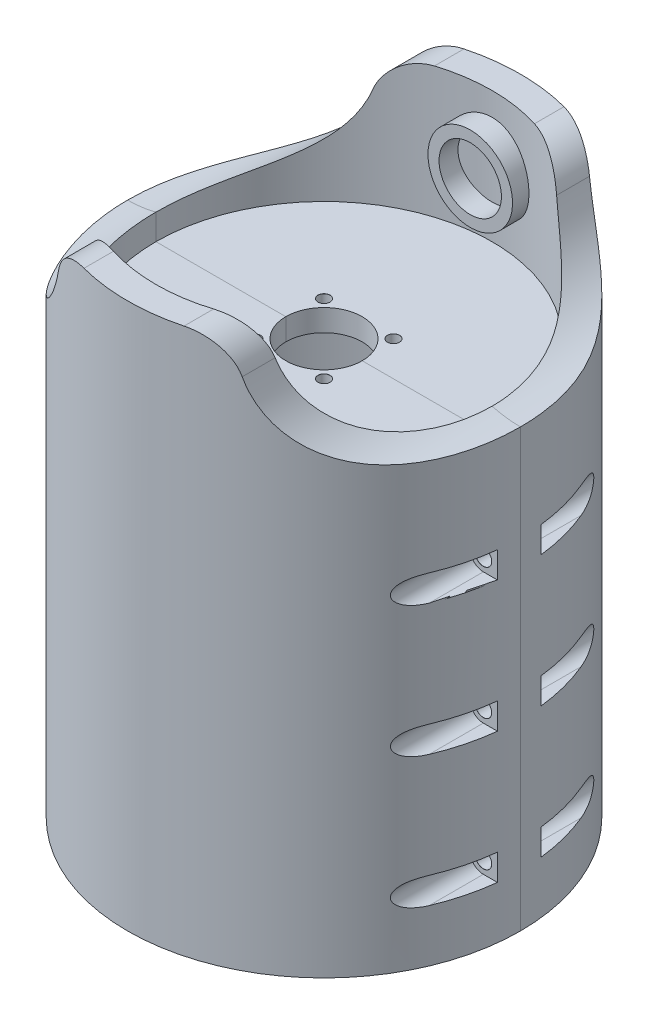
from build123d import *

# Parameters (mm, degrees)
SKETCH7_R                      = 90
BOSS_EXTRUDE3_DEPTH            = 250
SHELL3_T                       = -13
SKETCH9_R                      = 19.3675
SKETCH9_R_2                    = 14.287499999999989
BOSS_EXTRUDE4_DEPTH            = 10
CUT_EXTRUDE3_DEPTH             = 284.9013914196265
SKETCH12_R                     = 90.00000000000001
BOSS_EXTRUDE5_DEPTH            = 10
SKETCH14_R                     = 77.00000000000001
BOSS_EXTRUDE6_DEPTH            = 10
SKETCH15_R                     = 17.500000000000004
CUT_EXTRUDE4_DEPTH             = 10
CIRPATTERN1_COUNT              = 4
CUT_EXTRUDE5_DEPTH             = 281.5352029353892
CUT_EXTRUDE5_DEPTH_BACK        = 281.5352029353892
FILLET1_R                      = 20
CUT_EXTRUDE6_START             = -47.000000000000014
SKETCH19_R                     = 17.500000000000004
CUT_EXTRUDE6_DEPTH             = 47.000000000000014
M7_CLEARANCE_HOLE1_D           = 7.6
M7_CLEARANCE_HOLE1_CSINK_D     = 7.65
M7_CLEARANCE_HOLE1_CSINK_ANGLE = 90


with BuildPart() as part:
    # Sketch7 → Boss-Extrude3 (new body)
    with BuildSketch(Plane(origin=(0, 0, 0), x_dir=(1, 0, 0), z_dir=(0, 1, 0))):
        Circle(SKETCH7_R)
    extrude(amount=BOSS_EXTRUDE3_DEPTH)

    # Shell3
    shell3_openings = [part.faces().sort_by_distance(p)[0] for p in [
        (0, 250, 0),
        (0, 0, 0),
    ]]
    offset(amount=SHELL3_T, openings=shell3_openings, kind=Kind.INTERSECTION)

    # Sketch9 → Boss-Extrude4 (add)
    with BuildSketch(Plane(origin=(0, 0, 77.00000000000001), x_dir=(-1, 0, 0), z_dir=(0, 0, -1))):
        with Locations((0, 220)):
            Circle(SKETCH9_R)
        with Locations((0, 220)):
            Circle(SKETCH9_R_2, mode=Mode.SUBTRACT)
    boss_extrude4 = extrude(amount=BOSS_EXTRUDE4_DEPTH)

    # Mirror1: Boss-Extrude4 across plane
    add(boss_extrude4.mirror(Plane.XY))

    # Sketch11 → Cut-Extrude3 (cut, through all)
    with BuildSketch(Plane.XY.offset(10)):
        with BuildLine():
            Line((-82.99999999999994, 36.00000000000001), (-97.99999999999999, 36.00000000000001))
            Line((-97.99999999999999, 36.00000000000001), (-97.99999999999999, 23.999999999999993))
            Line((-97.99999999999999, 23.999999999999993), (-82.99999999999994, 23.999999999999993))
            ThreePointArc((-82.99999999999994, 23.999999999999993), (-76.99999999999994, 30), (-82.99999999999994, 36.00000000000001))
        make_face()
        with BuildLine():
            Line((-98, 95.99999999999999), (-97.99999999999999, 83.99999999999997))
            Line((-97.99999999999999, 83.99999999999997), (-82.99999999999996, 83.99999999999999))
            ThreePointArc((-82.99999999999996, 83.99999999999999), (-76.99999999999994, 90.00000000000001), (-82.99999999999997, 96))
            Line((-82.99999999999997, 96), (-98, 95.99999999999999))
        make_face()
        with BuildLine():
            Line((-98, 156), (-98, 144))
            Line((-98, 144), (-82.99999999999999, 143.99999999999997))
            ThreePointArc((-82.99999999999999, 143.99999999999997), (-76.99999999999996, 150), (-82.99999999999999, 156.00000000000003))
            Line((-82.99999999999999, 156.00000000000003), (-98, 156))
        make_face()
        with BuildLine():
            Line((-83, 216), (-98.00000000000003, 216.00000000000003))
            Line((-98.00000000000003, 216.00000000000003), (-98.00000000000003, 204))
            Line((-98.00000000000003, 204), (-83, 204))
            ThreePointArc((-83, 204), (-77, 210), (-83, 216))
        make_face()
        with BuildLine():
            Line((115.44794772964934, 96.00000000000003), (83.00000000000004, 96.00000000000003))
            ThreePointArc((83.00000000000004, 96.00000000000003), (77.00000000000004, 90.00000000000003), (83.00000000000004, 84.00000000000001))
            Line((83.00000000000004, 84.00000000000001), (115.44794772964934, 84.00000000000001))
            Line((115.44794772964934, 84.00000000000001), (115.44794772964934, 96.00000000000003))
        make_face()
        with BuildLine():
            Line((113.03560255320893, 156.00000000000003), (83.00000000000004, 156.00000000000003))
            ThreePointArc((83.00000000000004, 156.00000000000003), (77.00000000000003, 150.00000000000006), (83, 144.00000000000003))
            Line((83, 144.00000000000003), (113.03560255320893, 144.00000000000003))
            Line((113.03560255320893, 144.00000000000003), (113.03560255320893, 156.00000000000003))
        make_face()
        with BuildLine():
            Line((119.10423776125516, 216), (83.00000000000001, 216))
            ThreePointArc((83.00000000000001, 216), (77.00000000000001, 210), (83.00000000000001, 204))
            Line((83.00000000000001, 204), (119.10423776125516, 204))
            Line((119.10423776125516, 204), (119.10423776125516, 216))
        make_face()
        with BuildLine():
            Line((97.99999999999999, 23.999999999999993), (82.99999999999994, 23.999999999999993))
            ThreePointArc((82.99999999999994, 23.999999999999993), (76.99999999999994, 30), (82.99999999999994, 36.00000000000001))
            Line((82.99999999999994, 36.00000000000001), (97.99999999999999, 36.00000000000001))
            Line((97.99999999999999, 36.00000000000001), (97.99999999999999, 23.999999999999993))
        make_face()
    cut_extrude3 = extrude(amount=CUT_EXTRUDE3_DEPTH, mode=Mode.SUBTRACT)

    # Mirror2: Cut-Extrude3 across plane
    add(cut_extrude3.mirror(Plane.XY), mode=Mode.SUBTRACT)

    # Sketch12 → Boss-Extrude5 (add)
    with BuildSketch(Plane(origin=(0, 0, 0), x_dir=(1, 0, 0), z_dir=(0, 1, 0))):
        Circle(SKETCH12_R)
    extrude(amount=BOSS_EXTRUDE5_DEPTH)

    # Sketch14 → Boss-Extrude6 (add)
    with BuildSketch(Plane(origin=(0, 180, 0), x_dir=(1, 0, 0), z_dir=(0, 1, 0))):
        Circle(SKETCH14_R)
    extrude(amount=BOSS_EXTRUDE6_DEPTH)

    # Sketch15 → Cut-Extrude4 (cut)
    with BuildSketch(Plane(origin=(0, 190, 0), x_dir=(1, 0, 0), z_dir=(0, 1, 0))):
        Circle(SKETCH15_R)
    extrude(amount=-CUT_EXTRUDE4_DEPTH, mode=Mode.SUBTRACT)

    # Sketch17 → M5 Clearance Hole1 (revolve, cut)
    with BuildSketch(Plane(origin=(15.909902576697228, 190, -15.909902576697409), x_dir=(0, 0, 1), z_dir=(1, 0, 0))):
        Polygon((0, 0), (-2.85e-15, 11.652366702325795), (2.7499999999999964, 10.000000000000002), (2.749999999999998, 0.02500000000000072), (2.7749999999999995, -1.73e-15), align=None)
    m5_clearance_hole1 = revolve(axis=Axis((15.909902576697228, 196.35, -15.909902576697409), (0, -1, 0)), mode=Mode.SUBTRACT)

    # CirPattern1: M5 Clearance Hole1 ×4 about axis
    cirpattern1_axis = Axis((0, 10, 0), (0, 1, 0))
    for i in range(1, CIRPATTERN1_COUNT):
        add(m5_clearance_hole1.rotate(cirpattern1_axis, i * 360 / CIRPATTERN1_COUNT), mode=Mode.SUBTRACT)

    # Sketch18 → Cut-Extrude5 (cut, two sides: drawn at the far end of the back side and taken through both)
    with BuildSketch(Plane.XY.offset(-CUT_EXTRUDE5_DEPTH_BACK)):
        with BuildLine():
            Line((-40.00000000000001, 250), (-40.00000000000001, 270))
            Line((-40.00000000000001, 270), (-110, 270))
            Line((-110, 270), (-110, 200))
            Line((-110, 200), (-90, 200))
            ThreePointArc((-90, 200), (-54.64466094067263, 214.64466094067262), (-40.00000000000001, 250))
        make_face()
        with BuildLine():
            Line((110, 200), (90, 200))
            ThreePointArc((90, 200), (54.64466094067262, 214.64466094067262), (40.00000000000001, 250))
            Line((40.00000000000001, 250), (40.00000000000001, 270))
            Line((40.00000000000001, 270), (110, 270))
            Line((110, 270), (110, 200))
        make_face()
    extrude(amount=CUT_EXTRUDE5_DEPTH + CUT_EXTRUDE5_DEPTH_BACK, mode=Mode.SUBTRACT)

    # Fillet1
    fillet1_edges = [part.edges().sort_by_distance(p)[0] for p in [
        (40, 250, -73.20885704068479),
        (40, 250, 73.20885704068482),
        (-40, 250, 73.2088570406863),
        (-40, 250, -73.20885704068633),
    ]]
    fillet(fillet1_edges, radius=FILLET1_R)

    # Sketch19 → Cut-Extrude6 (cut)
    with BuildSketch(Plane.XZ.offset(CUT_EXTRUDE6_START)):
        Circle(SKETCH19_R)
    extrude(amount=CUT_EXTRUDE6_DEPTH, mode=Mode.SUBTRACT)

    # M7 Clearance Hole1 (through all)
    with Locations(Plane.XY.offset(10)):
        with Locations((-83, 150), (-83, 30), (83, 30), (83, 90), (83, 150), (-83, 90)):
            CounterSinkHole(M7_CLEARANCE_HOLE1_D / 2, M7_CLEARANCE_HOLE1_CSINK_D / 2, counter_sink_angle=M7_CLEARANCE_HOLE1_CSINK_ANGLE)


with BuildPart() as body_2:
    # Split1: the piece on the far side of the plane
    add(part.part)
    split(bisect_by=Plane.XY, keep=Keep.BOTTOM)


with BuildPart() as part_1:
    add(part.part)

    # Split1
    split(bisect_by=Plane.XY, keep=Keep.TOP)


solid = Compound([body_2.part, part_1.part])
